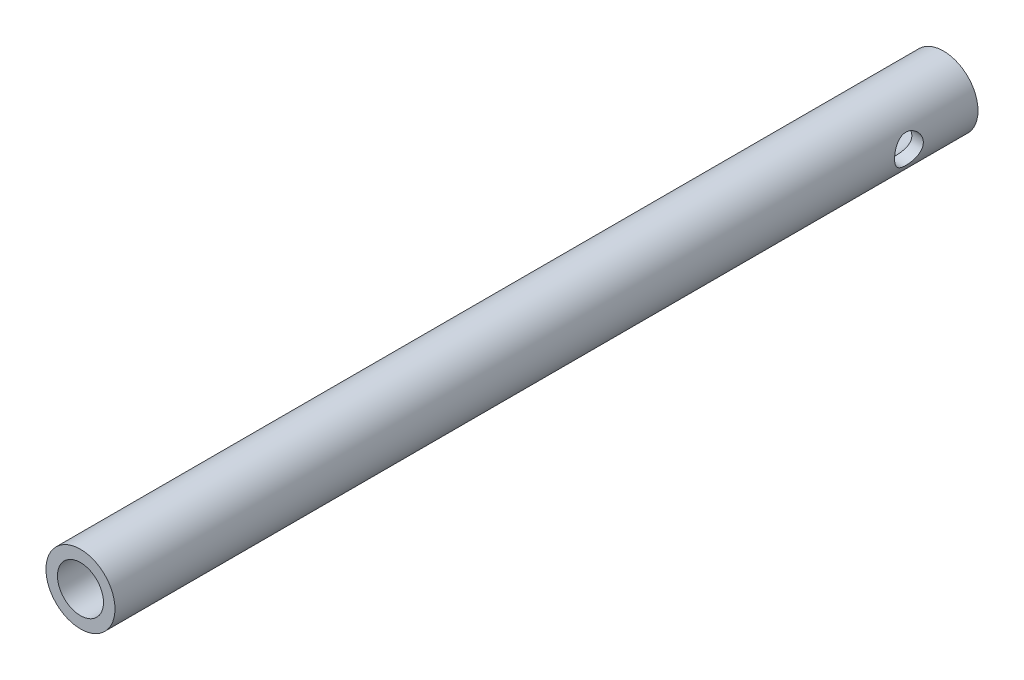
from build123d import *

# Parameters (mm, degrees)
ESQUISSE1_R                  = 3
ESQUISSE1_R_2                = 2
BOSS_EXTRU_1_DEPTH           = 75
ENL_V_MAT_EXTRU_1_DEPTH      = 76.119904153
ENL_V_MAT_EXTRU_1_DEPTH_BACK = 76.119904153
ESQUISSE2_R                  = 1.25


with BuildPart() as part:
    # Esquisse1 → Boss.-Extru.1 (new body)
    with BuildSketch(Plane.XY):
        Circle(ESQUISSE1_R)
        Circle(ESQUISSE1_R_2, mode=Mode.SUBTRACT)
    extrude(amount=BOSS_EXTRU_1_DEPTH)

    # Esquisse2 → Enlèv. mat.-Extru.1 (cut, two sides: drawn at the far end of the back side and taken through both)
    with BuildSketch(Plane(origin=(0, 0, 0), x_dir=(0, 0, -1), z_dir=(1, 0, 0)).offset(-ENL_V_MAT_EXTRU_1_DEPTH_BACK)):
        with Locations((-6, 0)):
            Circle(ESQUISSE2_R)
    extrude(amount=ENL_V_MAT_EXTRU_1_DEPTH + ENL_V_MAT_EXTRU_1_DEPTH_BACK, mode=Mode.SUBTRACT)


solid = part.part
